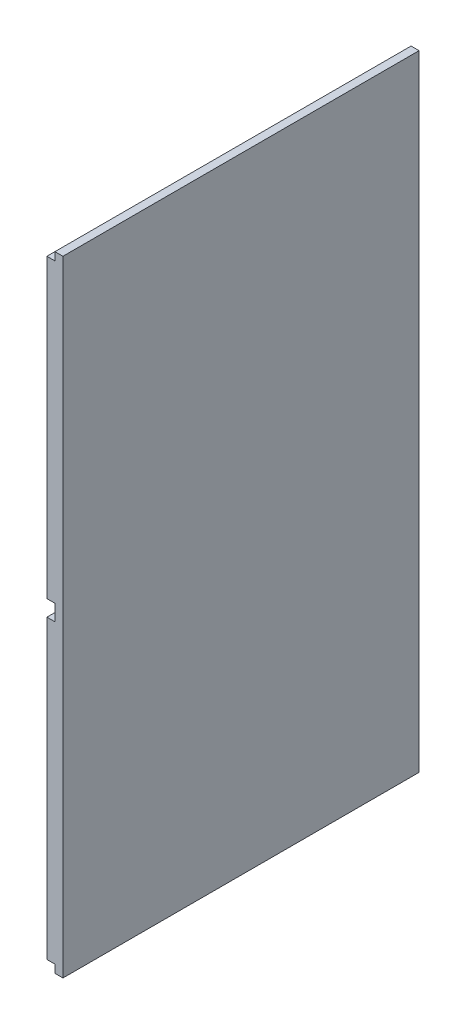
from build123d import *

# Parameters (mm, degrees)
SKETCH1_W           = 400
SKETCH1_H           = 702
BOSS_EXTRUDE1_DEPTH = 18
SKETCH2_W           = 400
SKETCH2_H           = 9
CUT_EXTRUDE1_DEPTH  = 9
SKETCH3_W           = 400
SKETCH3_H           = 18
CUT_EXTRUDE2_DEPTH  = 9


with BuildPart() as part:
    # Sketch1 → Boss-Extrude1 (new body)
    with BuildSketch(Plane(origin=(0, 0, 0), x_dir=(0, 0, -1), z_dir=(1, 0, 0))):
        Rectangle(SKETCH1_W, SKETCH1_H)
    extrude(amount=BOSS_EXTRUDE1_DEPTH)

    # Sketch2 → Cut-Extrude1 (cut)
    with BuildSketch(Plane.ZY):
        with Locations((0, -346.5)):
            Rectangle(SKETCH2_W, SKETCH2_H)
        with Locations((0, 346.5)):
            Rectangle(SKETCH2_W, SKETCH2_H)
    extrude(amount=-CUT_EXTRUDE1_DEPTH, mode=Mode.SUBTRACT)

    # Sketch3 → Cut-Extrude2 (cut)
    with BuildSketch(Plane.ZY):
        Rectangle(SKETCH3_W, SKETCH3_H)
    extrude(amount=-CUT_EXTRUDE2_DEPTH, mode=Mode.SUBTRACT)


solid = part.part
